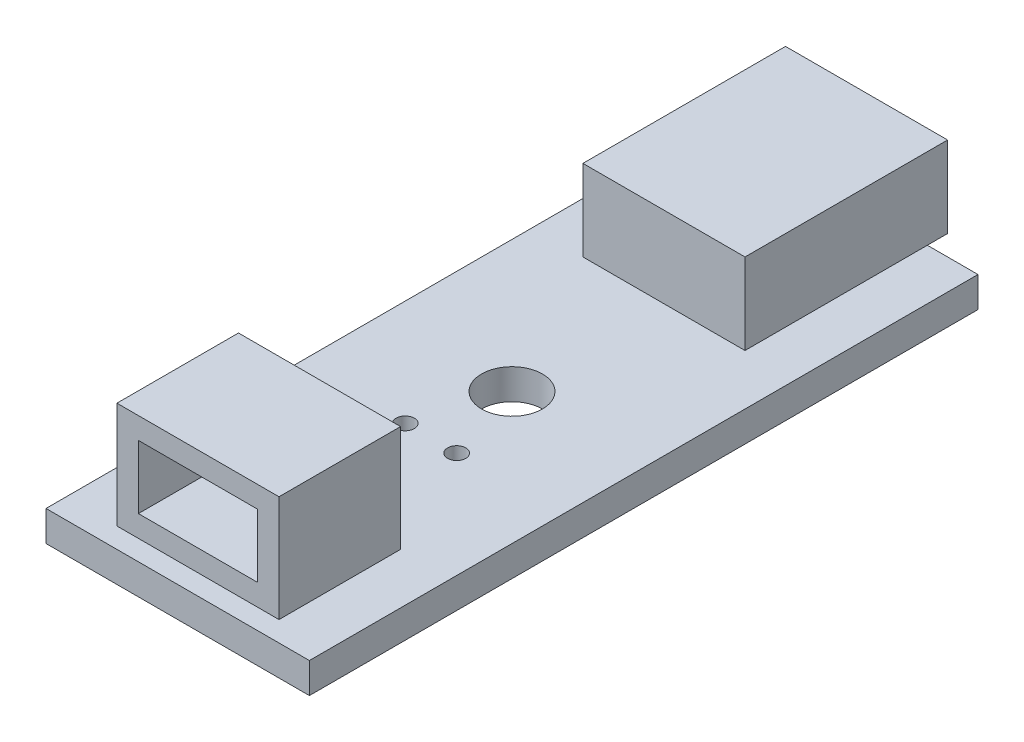
from build123d import *

# Parameters (mm, degrees)
SKETCH2_W           = 13
SKETCH2_H           = 33
BOSS_EXTRUDE1_DEPTH = 1.5
SKETCH3_W           = 8
SKETCH3_H           = 6
BOSS_EXTRUDE2_DEPTH = 5.25
SKETCH4_W           = 5.878679656
SKETCH4_H           = 3.128679656
CUT_EXTRUDE1_DEPTH  = 5
SKETCH5_R           = 1.5
CUT_EXTRUDE2_DEPTH  = 7
SKETCH6_R           = 0.45
CUT_EXTRUDE3_DEPTH  = 7
SKETCH7_W           = 8
SKETCH7_H           = 9
BOSS_EXTRUDE3_DEPTH = 4
SKETCH10_W          = 8
SKETCH10_H          = 4
BOSS_EXTRUDE5_DEPTH = 1
CUT_EXTRUDE5_DEPTH  = 5


with BuildPart() as part:
    # Sketch2 → Boss-Extrude1 (new body)
    with BuildSketch(Plane(origin=(0, 0, 0), x_dir=(1, 0, 0), z_dir=(0, 1, 0))):
        Rectangle(SKETCH2_W, SKETCH2_H)
    extrude(amount=BOSS_EXTRUDE1_DEPTH)

    # Sketch3 → Boss-Extrude2 (add)
    with BuildSketch(Plane(origin=(0, 1.5, 0), x_dir=(1, 0, 0), z_dir=(0, 1, 0))):
        with Locations((0, -12.5)):
            Rectangle(SKETCH3_W, SKETCH3_H)
    extrude(amount=BOSS_EXTRUDE2_DEPTH)

    # Sketch4 → Cut-Extrude1 (cut)
    with BuildSketch(Plane.XY.offset(15.5)):
        with Locations((0, 4.125)):
            Rectangle(SKETCH4_W, SKETCH4_H)
    extrude(amount=-CUT_EXTRUDE1_DEPTH, mode=Mode.SUBTRACT)

    # Sketch5 → Cut-Extrude2 (cut)
    with BuildSketch(Plane(origin=(0, 1.5, 0), x_dir=(1, 0, 0), z_dir=(0, 1, 0))):
        Circle(SKETCH5_R)
    extrude(amount=-CUT_EXTRUDE2_DEPTH, mode=Mode.SUBTRACT)

    # Sketch6 → Cut-Extrude3 (cut)
    with BuildSketch(Plane(origin=(0, 1.5, 0), x_dir=(1, 0, 0), z_dir=(0, 1, 0))):
        with Locations((-1.27, -4)):
            Circle(SKETCH6_R)
        with Locations((1.27, -4)):
            Circle(SKETCH6_R)
    extrude(amount=-CUT_EXTRUDE3_DEPTH, mode=Mode.SUBTRACT)

    # Sketch7 → Boss-Extrude3 (add)
    with BuildSketch(Plane(origin=(0, 1.5, 0), x_dir=(1, 0, 0), z_dir=(0, 1, 0))):
        with Locations((0, 12)):
            Rectangle(SKETCH7_W, SKETCH7_H)
    extrude(amount=BOSS_EXTRUDE3_DEPTH)

    # Sketch10 → Boss-Extrude5 (add)
    with BuildSketch(Plane(origin=(0, 0, -16.5), x_dir=(-1, 0, 0), z_dir=(0, 0, -1))):
        with Locations((0, 3.5)):
            Rectangle(SKETCH10_W, SKETCH10_H)
    extrude(amount=BOSS_EXTRUDE5_DEPTH)

    # Sketch12 → Cut-Extrude5 (cut)
    with BuildSketch(Plane(origin=(0, 0, -17.5), x_dir=(-1, 0, 0), z_dir=(0, 0, -1))):
        Polygon((-3.490849898, 5.00909726), (3.509150102, 5.00909726), (3.509150102, 3.75909726), (3.009150102, 3.00909726), (3.009150102, 2.00909726), (-2.990849898, 2.00909726), (-2.990849898, 3.00909726), (-3.490849898, 3.75909726), align=None)
    extrude(amount=-CUT_EXTRUDE5_DEPTH, mode=Mode.SUBTRACT)


solid = part.part
